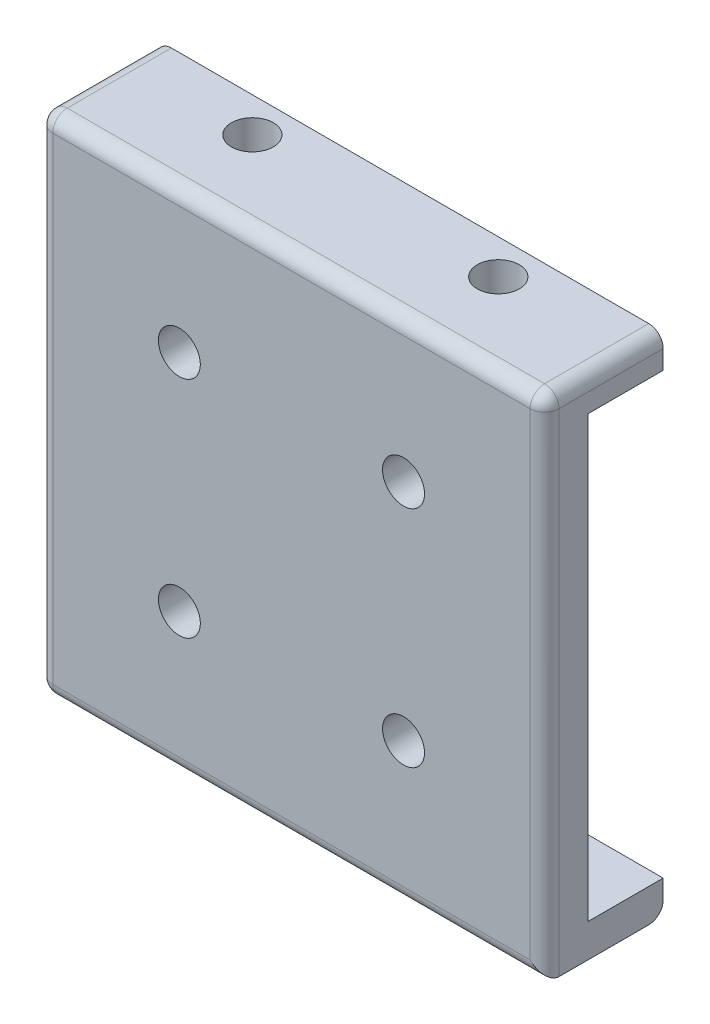
from build123d import *

# Parameters (mm, degrees)
ESQUISSE1_W             = 35
ESQUISSE1_H             = 35
BOSS_EXTRU_1_DEPTH      = 3
ESQUISSE2_W             = 35
ESQUISSE2_H             = 2.3
BOSS_EXTRU_2_DEPTH      = 5.2
ESQUISSE3_R             = 1.25
ENL_V_MAT_EXTRU_1_DEPTH = 45
D_GAGEMENT_M2_51_D      = 2.9
D_GAGEMENT_M2_52_D      = 2.9
D_GAGEMENT_M2_53_D      = 2.9
CONG_1_R                = 1


with BuildPart() as part:
    # Esquisse1 → Boss.-Extru.1 (new body)
    with BuildSketch(Plane.XY):
        with Locations((-2.901069519, 5.614973262)):
            Rectangle(ESQUISSE1_W, ESQUISSE1_H)
    extrude(amount=BOSS_EXTRU_1_DEPTH)

    # Esquisse2 → Boss.-Extru.2 (add)
    with BuildSketch(Plane(origin=(0, 0, 0), x_dir=(-1, 0, 0), z_dir=(0, 0, -1))):
        with Locations((2.901069519, 21.964973262)):
            Rectangle(ESQUISSE2_W, ESQUISSE2_H)
        with Locations((2.901069519, -10.735026738)):
            Rectangle(ESQUISSE2_W, ESQUISSE2_H)
    extrude(amount=BOSS_EXTRU_2_DEPTH)

    # Esquisse3 → Enlèv. mat.-Extru.1 (cut)
    with BuildSketch(Plane(origin=(0, 23.114973262, 0), x_dir=(1, 0, 0), z_dir=(0, 1, 0))):
        with Locations(Location((-11.401069519, 2.8, 0), (0, 0, 270))):
            Circle(ESQUISSE3_R)
        with Locations(Location((5.598930481, 2.8, 0), (0, 0, 270))):
            Circle(ESQUISSE3_R)
    extrude(amount=-ENL_V_MAT_EXTRU_1_DEPTH, mode=Mode.SUBTRACT)

    # Dégagement M2.51 (through all)
    with Locations(Plane(origin=(0, 23.114973262, 0), x_dir=(1, 0, 0), z_dir=(0, 1, 0))):
        with Locations((-11.401069519, 2.8), (5.598930481, 2.8)):
            Hole(D_GAGEMENT_M2_51_D / 2)

    # Dégagement M2.52 (through all)
    with Locations(Plane(origin=(0, -11.885026738, 0), x_dir=(-1, 0, 0), z_dir=(0, -1, 0))):
        with Locations((11.401069519, 2.8), (-5.598930481, 2.8)):
            Hole(D_GAGEMENT_M2_52_D / 2)

    # Dégagement M2.53 (through all)
    with Locations(Plane(origin=(0, 0, 0), x_dir=(-1, 0, 0), z_dir=(0, 0, -1))):
        with Locations((-4.848930481, 13.364973262), (10.651069519, 13.364973262), (10.651069519, -2.135026738), (-4.848930481, -2.135026738)):
            Hole(D_GAGEMENT_M2_53_D / 2)

    # Congé1
    # the kernel refuses this fillet: 1 mm, written as the material it takes off along each edge
    with BuildSketch(Plane(origin=(13.598930481, 22.114973262, 2), x_dir=(0, 0, 1), z_dir=(0, 1, 0))) as cong_1_piece_1_section:
        Polygon((0, 0), (CONG_1_R, 0), (CONG_1_R, CONG_1_R), (0, CONG_1_R), align=None)
    cong_1_piece_1 = extrude(amount=CONG_1_R, mode=Mode.PRIVATE)
    cong_1_piece_1 = cong_1_piece_1 - Plane(origin=(13.598930481, 22.114973262, 2), x_dir=(-0.7071067811865475, 0, -0.7071067811865475), z_dir=(0, 1, 0)) * Sphere(CONG_1_R, mode=Mode.PRIVATE)
    add(cong_1_piece_1, mode=Mode.SUBTRACT)
    with BuildSketch(Plane(origin=(-19.401069519, 22.114973262, 2), x_dir=(0, 0, 1), z_dir=(0, 1, 0))) as cong_1_piece_2_section:
        Polygon((0, 0), (CONG_1_R, 0), (CONG_1_R, -CONG_1_R), (0, -CONG_1_R), align=None)
    cong_1_piece_2 = extrude(amount=CONG_1_R, mode=Mode.PRIVATE)
    cong_1_piece_2 = cong_1_piece_2 - Plane(origin=(-19.401069519, 22.114973262, 2), x_dir=(0.7071067811865475, 0, -0.7071067811865475), z_dir=(0, 1, 0)) * Sphere(CONG_1_R, mode=Mode.PRIVATE)
    add(cong_1_piece_2, mode=Mode.SUBTRACT)
    with BuildSketch(Plane(origin=(-19.401069519, -10.885026738, 2), x_dir=(-1, 0, 0), z_dir=(0, 0, 1))) as cong_1_piece_3_section:
        Polygon((0, 0), (CONG_1_R, 0), (CONG_1_R, CONG_1_R), (0, CONG_1_R), align=None)
    cong_1_piece_3 = extrude(amount=CONG_1_R, mode=Mode.PRIVATE)
    cong_1_piece_3 = cong_1_piece_3 - Plane(origin=(-19.401069519, -10.885026738, 2), x_dir=(0.7071067811865475, 0.7071067811865477, 0), z_dir=(0, 0, 1)) * Sphere(CONG_1_R, mode=Mode.PRIVATE)
    add(cong_1_piece_3, mode=Mode.SUBTRACT)
    with BuildSketch(Plane(origin=(14.598930481, 22.114973262, 3), x_dir=(-1, 0, 0), z_dir=(0, -1, 0)), Plane(origin=(17.098930481, -11.885026738, 3), x_dir=(0, 1, 0), z_dir=(-1, 0, 0))) as cong_1_piece_4:
        with BuildLine():
            CenterArc((CONG_1_R, CONG_1_R), CONG_1_R, 180, 90)
            Line((0, CONG_1_R), (0, 0))
            Line((0, 0), (CONG_1_R, 0))
        make_face()
    extrude(amount=36.5, mode=Mode.SUBTRACT)
    with BuildSketch(Plane(origin=(-19.401069519, 23.114973262, 3), x_dir=(0, 0, -1), z_dir=(1, 0, 0))) as cong_1_piece_5:
        with BuildLine():
            CenterArc((CONG_1_R, -CONG_1_R), CONG_1_R, 90, 90)
            Line((0, -CONG_1_R), (0, 0))
            Line((0, 0), (CONG_1_R, 0))
        make_face()
    extrude(amount=33, mode=Mode.SUBTRACT)
    with BuildSketch(Plane(origin=(17.098930481, -11.885026738, -5.2), x_dir=(0, 0, 1), z_dir=(-1, 0, 0))) as cong_1_piece_6:
        with BuildLine():
            CenterArc((CONG_1_R, CONG_1_R), CONG_1_R, 180, 90)
            Line((0, CONG_1_R), (0, 0))
            Line((0, 0), (CONG_1_R, 0))
        make_face()
    extrude(amount=40, mode=Mode.SUBTRACT)
    with BuildSketch(Plane(origin=(-20.401069519, -10.885026738, 3), x_dir=(1, 0, 0), z_dir=(0, 1, 0))) as cong_1_piece_7:
        with BuildLine():
            CenterArc((CONG_1_R, CONG_1_R), CONG_1_R, 180, 90)
            Line((0, CONG_1_R), (0, 0))
            Line((0, 0), (CONG_1_R, 0))
        make_face()
    extrude(amount=33, mode=Mode.SUBTRACT)
    with BuildSketch(Plane(origin=(-20.401069519, 23.114973262, -7.7), x_dir=(1, 0, 0), z_dir=(0, 0, 1)), Plane(origin=(14.598930481, 23.114973262, 2), x_dir=(-1, 0, 0), z_dir=(0, 0, -1)), Plane(origin=(-20.401069519, -11.885026738, -7.7), x_dir=(0, 1, 0), z_dir=(0, 0, 1))) as cong_1_piece_8:
        with BuildLine():
            CenterArc((CONG_1_R, -CONG_1_R), CONG_1_R, 90, 90)
            Line((0, -CONG_1_R), (0, 0))
            Line((0, 0), (CONG_1_R, 0))
        make_face()
    extrude(amount=9.7, mode=Mode.SUBTRACT)


solid = part.part
